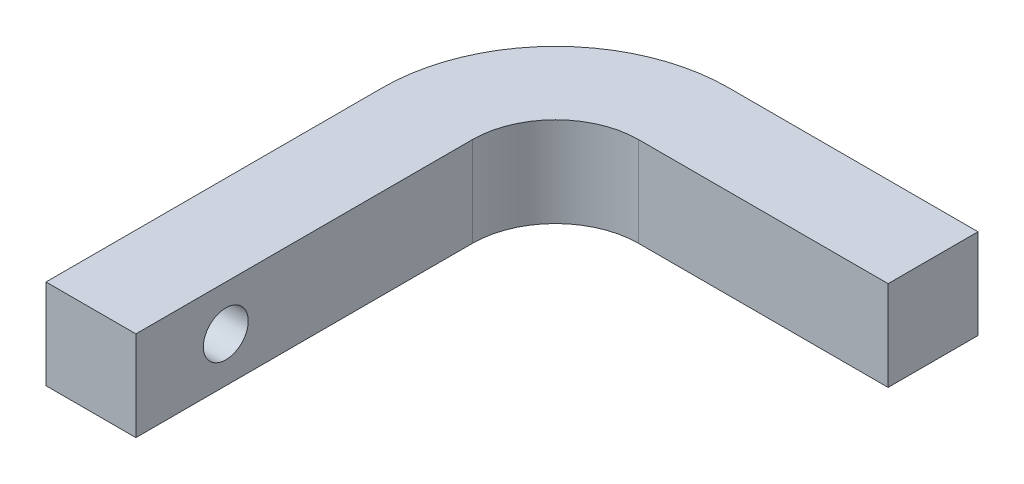
from build123d import *

# Parameters (mm, degrees)
BOSS_EXTRUDE1_DEPTH      = 4
BOSS_EXTRUDE1_DEPTH_BACK = 4
CUT_EXTRUDE1_DEPTH       = 55.294342247
CUT_EXTRUDE1_DEPTH_BACK  = 55.294342247
SKETCH2_R                = 2


with BuildPart() as part:
    # Sketch1 → Boss-Extrude1 (new, two sides: drawn at the far end of the back side and taken through both)
    with BuildSketch(Plane(origin=(0, 0, 0), x_dir=(1, 0, 0), z_dir=(0, 1, 0)).offset(-BOSS_EXTRUDE1_DEPTH_BACK)):
        with BuildLine():
            Line((-11.1, 0), (11.1, 0))
            Line((11.1, 0), (11.1, -8))
            Line((11.1, -8), (-11.1, -8))
            ThreePointArc((-11.1, -8), (-16.332590181, -10.167409819), (-18.5, -15.4))
            Line((-18.5, -15.4), (-18.5, -45.34))
            Line((-18.5, -45.34), (-26.5, -45.34))
            Line((-26.5, -45.34), (-26.5, -15.4))
            ThreePointArc((-26.5, -15.4), (-21.98944443, -4.51055557), (-11.1, 0))
        make_face()
    extrude(amount=BOSS_EXTRUDE1_DEPTH + BOSS_EXTRUDE1_DEPTH_BACK)

    # Sketch2 → Cut-Extrude1 (cut, two sides: drawn at the far end of the back side and taken through both)
    with BuildSketch(Plane.ZY.offset(18.5).offset(-CUT_EXTRUDE1_DEPTH_BACK)):
        with Locations((37.34, 0)):
            Circle(SKETCH2_R)
    extrude(amount=CUT_EXTRUDE1_DEPTH + CUT_EXTRUDE1_DEPTH_BACK, mode=Mode.SUBTRACT)


solid = part.part
